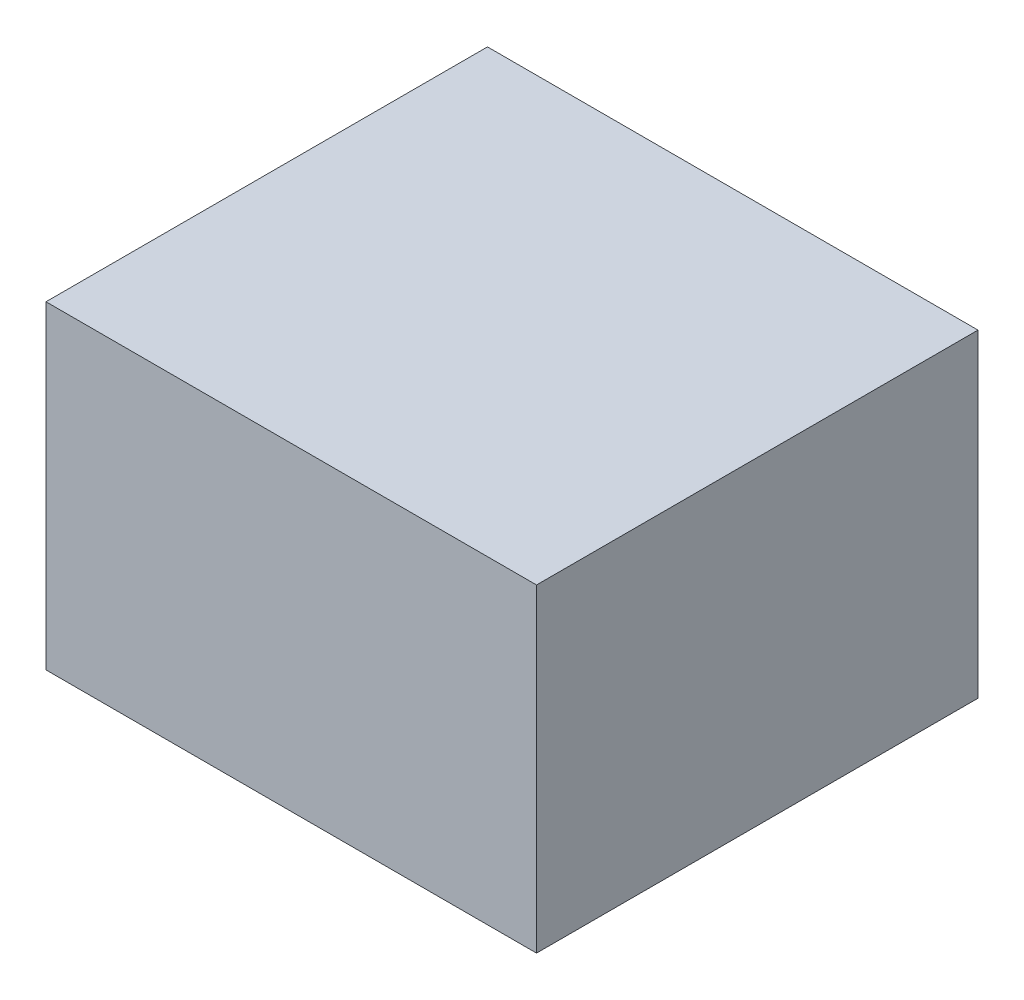
from build123d import *

# Parameters (mm, degrees)
SKETCH1_W           = 200
SKETCH1_H           = 180
BOSS_EXTRUDE1_DEPTH = 130


with BuildPart() as part:
    # Sketch1 → Boss-Extrude1 (new body)
    with BuildSketch(Plane(origin=(0, 50, 0), x_dir=(1, 0, 0), z_dir=(0, 1, 0))):
        with Locations((-147.034475432, 965.52938032)):
            Rectangle(SKETCH1_W, SKETCH1_H)
    extrude(amount=BOSS_EXTRUDE1_DEPTH)


solid = part.part
